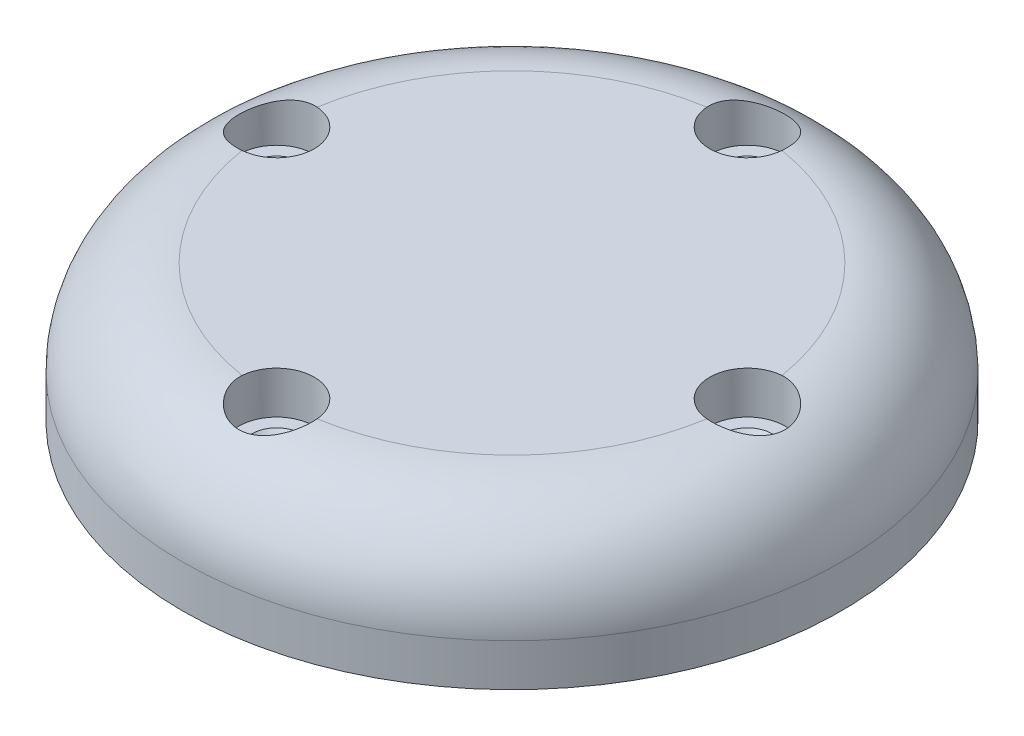
from build123d import *

# Parameters (mm, degrees)
BOSS_EXTRUDE1_START       = 3
SKETCH1_R                 = 35
SKETCH1_R_2               = 14
BOSS_EXTRUDE1_DEPTH       = 18
BOSS_EXTRUDE2_START       = 18
SKETCH1_3_R               = 14
BOSS_EXTRUDE2_DEPTH       = 3
BOSS_EXTRUDE3_START       = 9
SKETCH1_4_R               = 14
SKETCH1_4_R_2             = 13
BOSS_EXTRUDE3_DEPTH       = 9
CUT_EXTRUDE1_REACH        = 54.669
SKETCH2_R                 = 2.1
SKETCH2_3_R               = 4
SKETCH2_3_R_2             = 2.1
CUT_EXTRUDE2_DEPTH        = 4.5
CHAMFER1_SIZE             = 0.5
BOSS_EXTRUDE4_START       = 3
BOSS_EXTRUDE4_OUTLINE_R   = 14
BOSS_EXTRUDE4_OUTLINE_R_2 = 13
BOSS_EXTRUDE4_DEPTH       = 4.84
BOSS_EXTRUDE5_START       = 1
SKETCH3_R                 = 13
BOSS_EXTRUDE5_DEPTH       = 1
SKETCH4_R                 = 35
CUT_EXTRUDE3_DEPTH        = 3.5
FILLET1_R                 = 10


# Read off the part's stored shape, not the designer's step: Boss-Extrude4
with BuildPart() as part:
    # Sketch1 → Boss-Extrude1 (new body)
    with BuildSketch(Plane(origin=(0, 0, 0), x_dir=(1, 0, 0), z_dir=(0, 1, 0)).offset(BOSS_EXTRUDE1_START)):
        with Locations(Location((0, 0, 0), (0, 0, 270))):
            Circle(SKETCH1_R)
        with Locations(Location((0, 0, 0), (0, 0, 270))):
            Circle(SKETCH1_R_2, mode=Mode.SUBTRACT)
    extrude(amount=BOSS_EXTRUDE1_DEPTH)

    # Sketch1<3> → Boss-Extrude2 (add)
    with BuildSketch(Plane(origin=(0, 0, 0), x_dir=(1, 0, 0), z_dir=(0, 1, 0)).offset(BOSS_EXTRUDE2_START)):
        with Locations(Location((0, 0, 0), (0, 0, 270))):
            Circle(SKETCH1_3_R)
    extrude(amount=BOSS_EXTRUDE2_DEPTH)

    # Sketch1<4> → Boss-Extrude3 (add)
    with BuildSketch(Plane(origin=(0, 0, 0), x_dir=(1, 0, 0), z_dir=(0, 1, 0)).offset(BOSS_EXTRUDE3_START)):
        with Locations(Location((0, 0, 0), (0, 0, 270))):
            Circle(SKETCH1_4_R)
        with Locations(Location((0, 0, 0), (0, 0, 270))):
            Circle(SKETCH1_4_R_2, mode=Mode.SUBTRACT)
    extrude(amount=BOSS_EXTRUDE3_DEPTH)

    # Sketch2 → Cut-Extrude1 (cut, up to next)
    with BuildSketch(Plane(origin=(0, 21, 0), x_dir=(1, 0, 0), z_dir=(0, 1, 0)), mode=Mode.PRIVATE) as cut_extrude1_sk1:
        with Locations(Location((0, -25, 0), (0, 0, 270))):
            Circle(SKETCH2_R)
    cut_extrude1_tool1 = extrude(cut_extrude1_sk1.sketch, amount=-CUT_EXTRUDE1_REACH, mode=Mode.PRIVATE) & part.part
    # Sketch2 → Cut-Extrude1 (cut, up to next)
    with BuildSketch(Plane(origin=(0, 21, 0), x_dir=(1, 0, 0), z_dir=(0, 1, 0)), mode=Mode.PRIVATE) as cut_extrude1_sk2:
        with Locations(Location((-25, 0, 0), (0, 0, 270))):
            Circle(SKETCH2_R)
    cut_extrude1_tool2 = extrude(cut_extrude1_sk2.sketch, amount=-CUT_EXTRUDE1_REACH, mode=Mode.PRIVATE) & part.part
    # Sketch2 → Cut-Extrude1 (cut, up to next)
    with BuildSketch(Plane(origin=(0, 21, 0), x_dir=(1, 0, 0), z_dir=(0, 1, 0)), mode=Mode.PRIVATE) as cut_extrude1_sk3:
        with Locations(Location((25, 0, 0), (0, 0, 270))):
            Circle(SKETCH2_R)
    cut_extrude1_tool3 = extrude(cut_extrude1_sk3.sketch, amount=-CUT_EXTRUDE1_REACH, mode=Mode.PRIVATE) & part.part
    # Sketch2 → Cut-Extrude1 (cut, up to next)
    with BuildSketch(Plane(origin=(0, 21, 0), x_dir=(1, 0, 0), z_dir=(0, 1, 0)), mode=Mode.PRIVATE) as cut_extrude1_sk4:
        with Locations(Location((0, 25, 0), (0, 0, 270))):
            Circle(SKETCH2_R)
    cut_extrude1_tool4 = extrude(cut_extrude1_sk4.sketch, amount=-CUT_EXTRUDE1_REACH, mode=Mode.PRIVATE) & part.part
    add(cut_extrude1_tool1.solids().sort_by_distance((0, 21, 25))[0], mode=Mode.SUBTRACT)
    add(cut_extrude1_tool2.solids().sort_by_distance((-25, 21, 0))[0], mode=Mode.SUBTRACT)
    add(cut_extrude1_tool3.solids().sort_by_distance((25, 21, 0))[0], mode=Mode.SUBTRACT)
    add(cut_extrude1_tool4.solids().sort_by_distance((0, 21, -25))[0], mode=Mode.SUBTRACT)

    # Sketch2<3> → Cut-Extrude2 (cut)
    # profile 1 of 4: a face of its own
    with BuildSketch(Plane(origin=(0, 21, 0), x_dir=(1, 0, 0), z_dir=(0, 1, 0))):
        with Locations(Location((0, -25, 0), (0, 0, 270))):
            Circle(SKETCH2_3_R)
        with Locations(Location((0, -25, 0), (0, 0, 270))):
            Circle(SKETCH2_3_R_2, mode=Mode.SUBTRACT)
    # profile 2 of 4: a face of its own
    with BuildSketch(Plane(origin=(0, 21, 0), x_dir=(1, 0, 0), z_dir=(0, 1, 0))):
        with Locations(Location((-25, 0, 0), (0, 0, 270))):
            Circle(SKETCH2_3_R)
        with Locations(Location((-25, 0, 0), (0, 0, 270))):
            Circle(SKETCH2_3_R_2, mode=Mode.SUBTRACT)
    # profile 3 of 4: a face of its own
    with BuildSketch(Plane(origin=(0, 21, 0), x_dir=(1, 0, 0), z_dir=(0, 1, 0))):
        with Locations(Location((0, 25, 0), (0, 0, 270))):
            Circle(SKETCH2_3_R)
        with Locations(Location((0, 25, 0), (0, 0, 270))):
            Circle(SKETCH2_3_R_2, mode=Mode.SUBTRACT)
    # profile 4 of 4: a face of its own
    with BuildSketch(Plane(origin=(0, 21, 0), x_dir=(1, 0, 0), z_dir=(0, 1, 0))):
        with Locations(Location((25, 0, 0), (0, 0, 270))):
            Circle(SKETCH2_3_R)
        with Locations(Location((25, 0, 0), (0, 0, 270))):
            Circle(SKETCH2_3_R_2, mode=Mode.SUBTRACT)
    extrude(amount=-CUT_EXTRUDE2_DEPTH, mode=Mode.SUBTRACT)

    # Chamfer1
    chamfer1_edges = [part.edges().sort_by_distance(p)[0] for p in [
        (0, 16.5, 22.9),
        (-25, 16.5, -2.1),
        (0, 16.5, -27.1),
        (25, 16.5, -2.1),
    ]]
    chamfer(chamfer1_edges, length=CHAMFER1_SIZE)

    # Boss-Extrude4 outline → Boss-Extrude4 (add)
    with BuildSketch(Plane(origin=(0, 0, 0), x_dir=(1, 0, 0), z_dir=(0, 1, 0)).offset(BOSS_EXTRUDE4_START)):
        Circle(BOSS_EXTRUDE4_OUTLINE_R)
        Circle(BOSS_EXTRUDE4_OUTLINE_R_2, mode=Mode.SUBTRACT)
    extrude(amount=BOSS_EXTRUDE4_DEPTH)

    # Sketch3 → Boss-Extrude5 (add)
    with BuildSketch(Plane.XZ.offset(-18).offset(BOSS_EXTRUDE5_START)):
        with Locations(Location((0, 0, 0), (0, 0, 270))):
            Circle(SKETCH3_R)
    extrude(amount=-BOSS_EXTRUDE5_DEPTH)

    # Sketch4 → Cut-Extrude3 (cut)
    with BuildSketch(Plane.XZ.offset(-3)):
        with Locations(Location((0, 0, 0), (0, 0, 270))):
            Circle(SKETCH4_R)
    extrude(amount=-CUT_EXTRUDE3_DEPTH, mode=Mode.SUBTRACT)

    # Fillet1
    # the kernel refuses this fillet: 10 mm, written as the material it takes off along each edge
    with BuildSketch(Plane(origin=(0, 21, 0), x_dir=(0, 0, 1), z_dir=(-1, 0, 0))) as fillet1_piece_1:
        with BuildLine():
            CenterArc((35 - FILLET1_R, -FILLET1_R), FILLET1_R, 0, 90)
            Line((35, -FILLET1_R), (35, 0))
            Line((35, 0), (35 - FILLET1_R, 0))
        make_face()
    revolve(axis=Axis((0, 21, 0), (0, 1, 0)), mode=Mode.SUBTRACT)


solid = part.part
